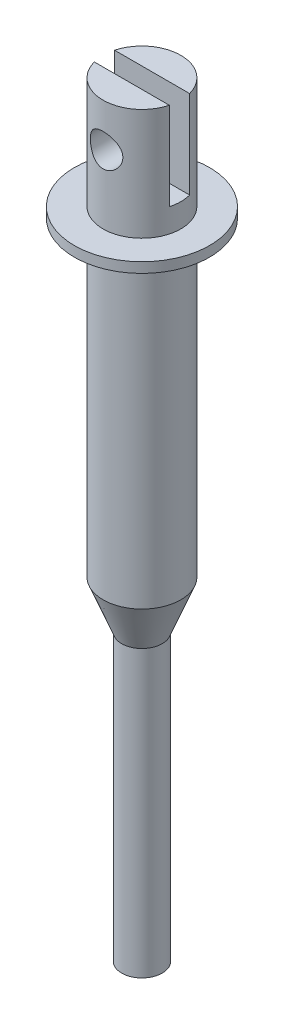
from build123d import *

# Parameters (mm, degrees)
CUT_EXTRUDE1_DEPTH      = 57.745847866
CUT_EXTRUDE1_DEPTH_BACK = 57.745847866
SKETCH2_R               = 1.2
SKETCH3_W               = 5.75
SKETCH3_H               = 1.5
CUT_EXTRUDE2_DEPTH      = 6.5
SKETCH4_R               = 5
BOSS_EXTRUDE1_DEPTH     = 0.75


with BuildPart() as part:
    # Sketch1 → Revolve1 (revolve)
    with BuildSketch(Plane.XY):
        Polygon((0, 0), (1.5, 0), (1.5, 21.1), (2.875, 24.6), (2.875, 56.6), (0, 56.6), align=None)
    revolve(axis=Axis((0, 56.6, 0), (0, -1, 0)))

    # Sketch2 → Cut-Extrude1 (cut, two sides: drawn at the far end of the back side and taken through both)
    with BuildSketch(Plane.XY.offset(-CUT_EXTRUDE1_DEPTH_BACK)):
        with Locations((0, 53.4)):
            Circle(SKETCH2_R)
    extrude(amount=CUT_EXTRUDE1_DEPTH + CUT_EXTRUDE1_DEPTH_BACK, mode=Mode.SUBTRACT)

    # Sketch3 → Cut-Extrude2 (cut)
    with BuildSketch(Plane(origin=(0, 56.6, 0), x_dir=(1, 0, 0), z_dir=(0, 1, 0))):
        Rectangle(SKETCH3_W, SKETCH3_H)
    extrude(amount=-CUT_EXTRUDE2_DEPTH, mode=Mode.SUBTRACT)

    # Sketch4 → Boss-Extrude1 (add)
    with BuildSketch(Plane(origin=(0, 47.6, 0), x_dir=(1, 0, 0), z_dir=(0, 1, 0))):
        Circle(SKETCH4_R)
    extrude(amount=BOSS_EXTRUDE1_DEPTH)


solid = part.part
